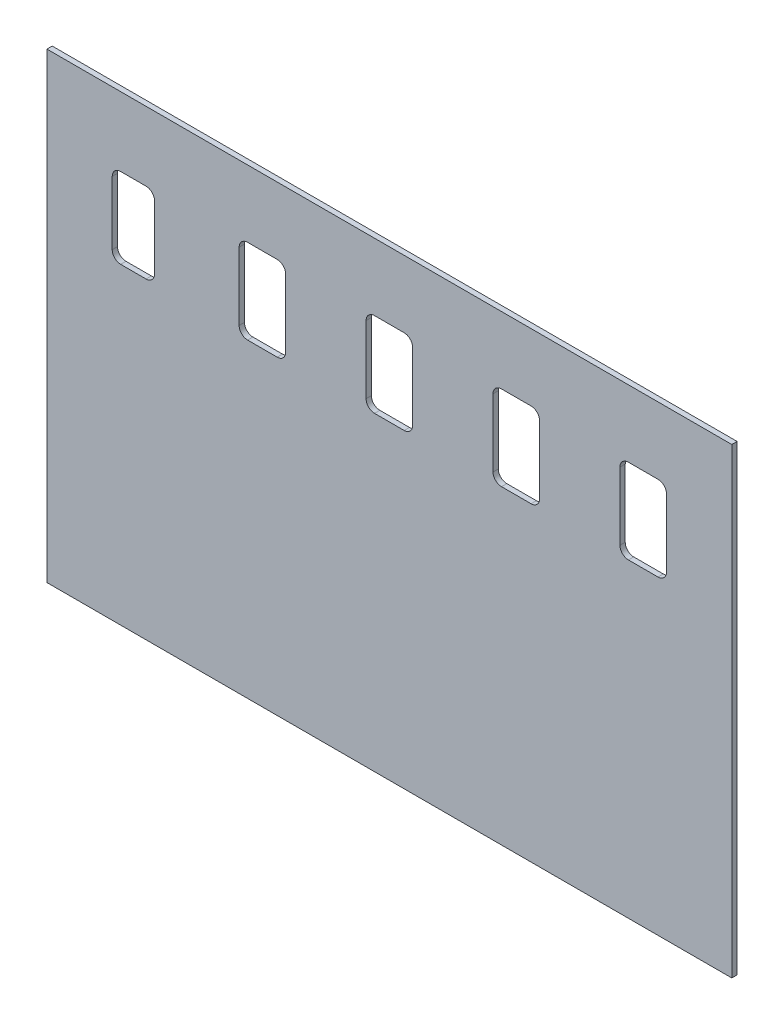
from build123d import *

# Parameters (mm, degrees)
SKETCH3_W           = 411.1625
SKETCH3_H           = 277.368
BOSS_EXTRUDE1_DEPTH = 1.5875
CUT_EXTRUDE1_DEPTH  = 25.4


with BuildPart() as part:
    # Sketch3 → Boss-Extrude1 (new, symmetric)
    with BuildSketch(Plane.XY):
        Rectangle(SKETCH3_W, SKETCH3_H)
    extrude(amount=BOSS_EXTRUDE1_DEPTH, both=True)

    # Sketch4 → Cut-Extrude1 (cut)
    with BuildSketch(Plane.XY.offset(1.5875)):
        with BuildLine():
            Line((8.89, 98.4326708), (-8.89, 98.4326708))
            ThreePointArc((-8.89, 98.4326708), (-12.482102448, 96.944773248), (-13.97, 93.3526708))
            Line((-13.97, 93.3526708), (-13.97, 52.7126708))
            ThreePointArc((-13.97, 52.7126708), (-12.482102448, 49.120568352), (-8.89, 47.6326708))
            Line((-8.89, 47.6326708), (8.89, 47.6326708))
            ThreePointArc((8.89, 47.6326708), (12.482102448, 49.120568352), (13.97, 52.7126708))
            Line((13.97, 52.7126708), (13.97, 93.3526708))
            ThreePointArc((13.97, 93.3526708), (12.482102448, 96.944773248), (8.89, 98.4326708))
        make_face()
        with BuildLine():
            Line((85.09, 98.4326708), (67.31, 98.4326708))
            ThreePointArc((67.31, 98.4326708), (63.717897552, 96.944773248), (62.23, 93.3526708))
            Line((62.23, 93.3526708), (62.23, 52.7126708))
            ThreePointArc((62.23, 52.7126708), (63.717897552, 49.120568352), (67.31, 47.6326708))
            Line((67.31, 47.6326708), (85.09, 47.6326708))
            ThreePointArc((85.09, 47.6326708), (88.682102448, 49.120568352), (90.17, 52.7126708))
            Line((90.17, 52.7126708), (90.17, 93.3526708))
            ThreePointArc((90.17, 93.3526708), (88.682102448, 96.944773248), (85.09, 98.4326708))
        make_face()
        with BuildLine():
            Line((161.29, 98.4326708), (143.51, 98.4326708))
            ThreePointArc((143.51, 98.4326708), (139.917897552, 96.944773248), (138.43, 93.3526708))
            Line((138.43, 93.3526708), (138.43, 52.7126708))
            ThreePointArc((138.43, 52.7126708), (139.917897552, 49.120568352), (143.51, 47.6326708))
            Line((143.51, 47.6326708), (161.29, 47.6326708))
            ThreePointArc((161.29, 47.6326708), (164.882102448, 49.120568352), (166.37, 52.7126708))
            Line((166.37, 52.7126708), (166.37, 93.3526708))
            ThreePointArc((166.37, 93.3526708), (164.882102448, 96.944773248), (161.29, 98.4326708))
        make_face()
        with BuildLine():
            Line((-67.31, 98.4326708), (-85.09, 98.4326708))
            ThreePointArc((-85.09, 98.4326708), (-88.682102448, 96.944773248), (-90.17, 93.3526708))
            Line((-90.17, 93.3526708), (-90.17, 52.7126708))
            ThreePointArc((-90.17, 52.7126708), (-88.682102448, 49.120568352), (-85.09, 47.6326708))
            Line((-85.09, 47.6326708), (-67.31, 47.6326708))
            ThreePointArc((-67.31, 47.6326708), (-63.717897552, 49.120568352), (-62.23, 52.7126708))
            Line((-62.23, 52.7126708), (-62.23, 93.3526708))
            ThreePointArc((-62.23, 93.3526708), (-63.717897552, 96.944773248), (-67.31, 98.4326708))
        make_face()
        with BuildLine():
            Line((-146.05, 97.1626708), (-161.29, 97.1626708))
            ThreePointArc((-161.29, 97.1626708), (-164.882102448, 95.674773248), (-166.37, 92.0826708))
            Line((-166.37, 92.0826708), (-166.37, 53.9826708))
            ThreePointArc((-166.37, 53.9826708), (-164.882102448, 50.390568352), (-161.29, 48.9026708))
            Line((-161.29, 48.9026708), (-146.05, 48.9026708))
            ThreePointArc((-146.05, 48.9026708), (-142.457897552, 50.390568352), (-140.97, 53.9826708))
            Line((-140.97, 53.9826708), (-140.97, 92.0826708))
            ThreePointArc((-140.97, 92.0826708), (-142.457897552, 95.674773248), (-146.05, 97.1626708))
        make_face()
    extrude(amount=-CUT_EXTRUDE1_DEPTH, mode=Mode.SUBTRACT)


solid = part.part
